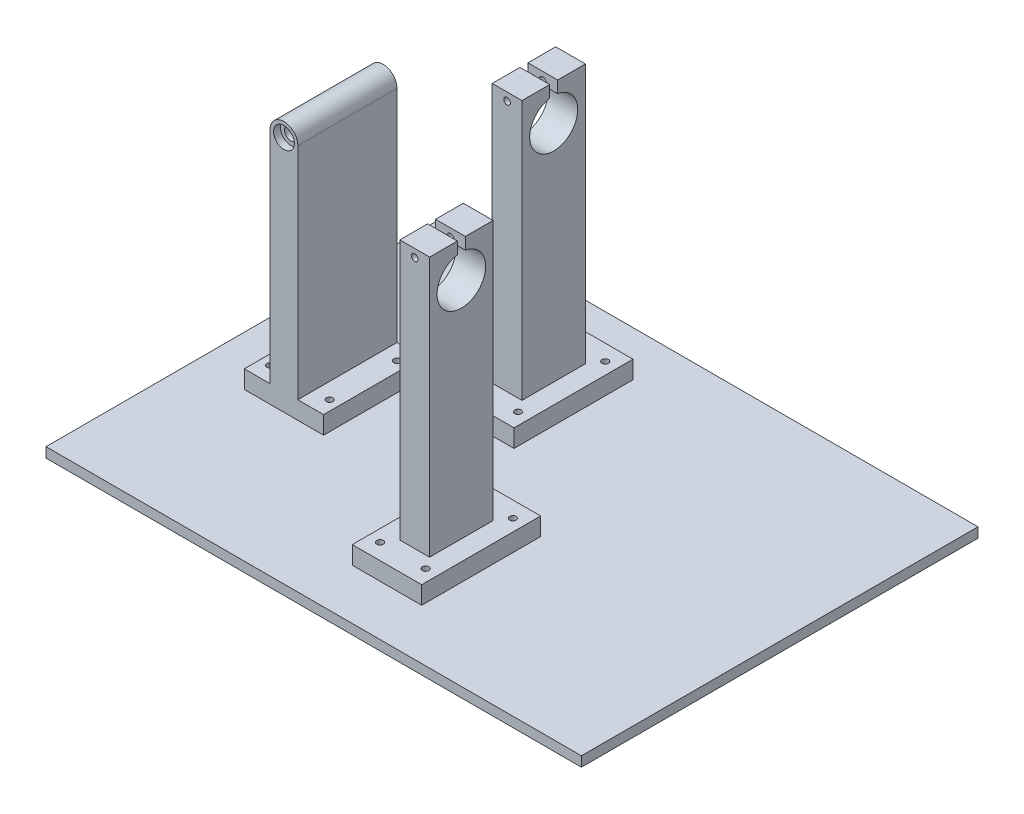
from build123d import *

# Parameters (mm, degrees)
SKETCH_2_W                 = 240.549430728
SKETCH_2_H                 = 149.540933388
EXTRUDE_1_DEPTH            = 5
SKETCH_6_W                 = 93.246571425
SKETCH_6_H                 = 149.540933388
EXTRUDE_4_DEPTH            = 5
SKETCH_8_W                 = 274.716709757
SKETCH_8_H                 = 58.51354913
EXTRUDE_6_DEPTH            = 5
CUT_EXTRUDE_2_DEPTH        = 252.755772101
CUT_EXTRUDE_2_DEPTH_BACK   = 252.755772101
SKETCH_9_W                 = 59.079292396
SKETCH_9_H                 = 149.540933388
SKETCH_10_W                = 104.703380117
SKETCH_10_H                = 208.054482518
CUT_EXTRUDE_3_DEPTH        = 10
SKETCH_12_W                = 200
SKETCH_12_H                = 200
EXTRUDE_7_DEPTH            = 5
SKETCH_13_OUTSIDE_W        = 259.728
SKETCH_13_OUTSIDE_H        = 267.782
SKETCH_13_OUTSIDE_W_2      = 200
SKETCH_13_OUTSIDE_H_2      = 200
CUT_EXTRUDE_4_DEPTH        = 278.64321362
EXTRUDE_START              = -75
SKETCH_18_R                = 5.25
EXTRUDE_9_DEPTH            = 10
EXTRUDE_START_2            = -46
EXTRUDE_10_DEPTH           = 15
EXTRUDE_START_3            = -91.2
EXTRUDE_11_DEPTH           = 15
EXTRUDE_12_REACH           = 307.894
SKETCH_20_R                = 5.25
SKETCH_26_W                = 200
SKETCH_26_H                = 5
EXTRUDE_13_DEPTH           = 100
SKETCH_27_W                = 200
SKETCH_27_H                = 5
CUT_EXTRUDE_5_DEPTH        = 30
EXTRUDE_14_DEPTH           = 10
SKETCH_29_W                = 60
SKETCH_29_H                = 9
EXTRUDE_15_DEPTH           = 10
HOLE_WIZARD_M4_1_OUTLINE_R = 1.65
HOLE_WIZARD_M4_1_DEPTH     = 14
HOLE_WIZARD_M4_2_D         = 3.3
HOLE_START                 = -37.990466694
HOLE_WIZARD_M4_3_OUTLINE_R = 1.65
HOLE_WIZARD_M4_3_DEPTH     = 32
EXTRUDE_16_DEPTH           = 10
SKETCH_37_W                = 60
SKETCH_37_H                = 9
EXTRUDE_17_DEPTH           = 10
HOLE_WIZARD_M4_4_OUTLINE_R = 1.65
HOLE_WIZARD_M4_4_DEPTH     = 14
EXTRUDE_START_4            = -3.5
SKETCH_40_R                = 5.25
SKETCH_40_R_2              = 3.25
EXTRUDE_18_DEPTH           = 46.5
CUT_EXTRUDE_START          = -3.5
SKETCH_41_R                = 5.25
SKETCH_41_R_2              = 3.25
CUT_EXTRUDE_6_DEPTH        = 3.5
HOLE_WIZARD_M4_5_OUTLINE_R = 1.65
HOLE_WIZARD_M4_5_DEPTH     = 14


# Read off the part's stored shape, not the designer's step: M4 螺纹孔1, M4 螺纹孔3, M4 螺纹孔4, M4 螺纹孔5
with BuildPart() as part:
    # 草图2 → 凸台-拉伸1 (new body)
    with BuildSketch(Plane(origin=(0, 0, 0), x_dir=(1, 0, 0), z_dir=(0, 1, 0))):
        Rectangle(SKETCH_2_W, SKETCH_2_H)
    extrude(amount=EXTRUDE_1_DEPTH)

    # 草图6 → 凸台-拉伸4 (add)
    with BuildSketch(Plane(origin=(0, 5, 0), x_dir=(1, 0, 0), z_dir=(0, 1, 0))):
        with Locations((166.898001077, 0)):
            Rectangle(SKETCH_6_W, SKETCH_6_H)
    extrude(amount=-EXTRUDE_4_DEPTH)

    # 草图8 → 凸台-拉伸6 (add)
    with BuildSketch(Plane(origin=(0, 5, 0), x_dir=(1, 0, 0), z_dir=(0, 1, 0))):
        with Locations((76.162931911, -104.027241259)):
            Rectangle(SKETCH_8_W, SKETCH_8_H)
    extrude(amount=-EXTRUDE_6_DEPTH)

    # 草图9 → 切除-拉伸2 (cut, two sides: drawn at the far end of the back side and taken through both)
    with BuildSketch(Plane(origin=(0, 5, 0), x_dir=(1, 0, 0), z_dir=(0, 1, 0)).offset(-CUT_EXTRUDE_2_DEPTH_BACK)):
        with Locations((-90.735069166, 0)):
            Rectangle(SKETCH_9_W, SKETCH_9_H)
    extrude(amount=CUT_EXTRUDE_2_DEPTH + CUT_EXTRUDE_2_DEPTH_BACK, mode=Mode.SUBTRACT)

    # 草图10 → 切除-拉伸3 (cut)
    with BuildSketch(Plane(origin=(0, 5, 0), x_dir=(1, 0, 0), z_dir=(0, 1, 0))):
        with Locations((-8.84373291, -29.256774565)):
            Rectangle(SKETCH_10_W, SKETCH_10_H)
    extrude(amount=-CUT_EXTRUDE_3_DEPTH, mode=Mode.SUBTRACT)

    # 草图12 → 凸台-拉伸7 (add)
    with BuildSketch(Plane(origin=(0, 5, 0), x_dir=(1, 0, 0), z_dir=(0, 1, 0))):
        with Locations((143.507957149, -25.229533306)):
            Rectangle(SKETCH_12_W, SKETCH_12_H)
    extrude(amount=-EXTRUDE_7_DEPTH)

    # 草图13 outside → 切除-拉伸4 (cut, through all)
    with BuildSketch(Plane(origin=(0, 5, 0), x_dir=(1, 0, 0), z_dir=(0, 1, 0))):
        with Locations((143.508, -29.257)):
            Rectangle(SKETCH_13_OUTSIDE_W, SKETCH_13_OUTSIDE_H)
        with Locations((143.507957149, -25.229533306)):
            Rectangle(SKETCH_13_OUTSIDE_W_2, SKETCH_13_OUTSIDE_H_2, mode=Mode.SUBTRACT)
    extrude(amount=-CUT_EXTRUDE_4_DEPTH, mode=Mode.SUBTRACT)

    # 草图18 → 凸台-拉伸9 (add)
    with BuildSketch(Plane.XY.offset(125.229533306).offset(EXTRUDE_START)):
        with BuildLine():
            Line((95.507957149, 14), (95.507957149, 125))
            ThreePointArc((95.507957149, 125), (88.507957149, 132), (81.507957149, 125))
            Line((81.507957149, 125), (81.507957149, 14))
            Line((81.507957149, 14), (68.507957149, 14))
            Line((68.507957149, 14), (68.507957149, 5))
            Line((68.507957149, 5), (108.507957149, 5))
            Line((108.507957149, 5), (108.507957149, 14))
            Line((108.507957149, 14), (95.507957149, 14))
        make_face()
        with Locations((88.507957149, 125)):
            Circle(SKETCH_18_R, mode=Mode.SUBTRACT)
    extrude_9 = extrude(amount=-EXTRUDE_9_DEPTH)

    # 镜向1: 凸台-拉伸9 across plane
    add(extrude_9.mirror(Plane.XY.offset(25.229533306)))

    # 草图16 → 凸台-拉伸10 (add)
    with BuildSketch(Plane(origin=(243.507957149, 0, 0), x_dir=(0, 0, -1), z_dir=(1, 0, 0)).offset(EXTRUDE_START_2)):
        with BuildLine():
            Line((-53.779533306, 14), (-53.779533306, 145.085631965))
            Line((-53.779533306, 145.085631965), (-67.779533306, 145.085631965))
            Line((-67.779533306, 145.085631965), (-67.779533306, 139.085631965))
            ThreePointArc((-67.779533306, 139.085631965), (-69.779533306, 114.75), (-71.779533306, 139.085631965))
            Line((-71.779533306, 139.085631965), (-71.779533306, 145.085631965))
            Line((-71.779533306, 145.085631965), (-85.779533306, 145.085631965))
            Line((-85.779533306, 145.085631965), (-85.779533306, 14))
            Line((-85.779533306, 14), (-99.779533306, 14))
            Line((-99.779533306, 14), (-99.779533306, 5))
            Line((-99.779533306, 5), (-39.779533306, 5))
            Line((-39.779533306, 5), (-39.779533306, 14))
            Line((-39.779533306, 14), (-53.779533306, 14))
        make_face()
    extrude(amount=-EXTRUDE_10_DEPTH)

    # 草图19 → 凸台-拉伸11 (add)
    with BuildSketch(Plane(origin=(243.507957149, 0, 0), x_dir=(0, 0, -1), z_dir=(1, 0, 0)).offset(EXTRUDE_START_3)):
        with BuildLine():
            Line((37.990466694, 14), (37.990466694, 144.933566106))
            Line((37.990466694, 144.933566106), (23.990466694, 144.933566106))
            Line((23.990466694, 144.933566106), (23.990466694, 138.933566106))
            ThreePointArc((23.990466694, 138.933566106), (21.990466694, 114.9), (19.990466694, 138.933566106))
            Line((19.990466694, 138.933566106), (19.990466694, 144.933566106))
            Line((19.990466694, 144.933566106), (5.990466694, 144.933566106))
            Line((5.990466694, 144.933566106), (5.990466694, 14))
            Line((5.990466694, 14), (-8.009533306, 14))
            Line((-8.009533306, 14), (-8.009533306, 5))
            Line((-8.009533306, 5), (51.990466694, 5))
            Line((51.990466694, 5), (51.990466694, 14))
            Line((51.990466694, 14), (37.990466694, 14))
        make_face()
    extrude(amount=-EXTRUDE_11_DEPTH)

    # 草图20 → 凸台-拉伸12 (add, up to next)
    with BuildSketch(Plane(origin=(0, 0, 40.229533306), x_dir=(-1, 0, 0), z_dir=(0, 0, -1)), mode=Mode.PRIVATE) as extrude_12_sk1:
        with BuildLine():
            Line((-108.507957149, 5), (-68.507957149, 5))
            Line((-68.507957149, 5), (-68.507957149, 14))
            Line((-68.507957149, 14), (-81.507957149, 14))
            Line((-81.507957149, 14), (-81.507957149, 125))
            ThreePointArc((-81.507957149, 125), (-88.507957149, 132), (-95.507957149, 125))
            Line((-95.507957149, 125), (-95.507957149, 14))
            Line((-95.507957149, 14), (-108.507957149, 14))
            Line((-108.507957149, 14), (-108.507957149, 5))
        make_face()
        with Locations(Location((-88.507957149, 125, 0), (0, 0, 180))):
            Circle(SKETCH_20_R, mode=Mode.SUBTRACT)
    extrude_12_tool1 = extrude(extrude_12_sk1.sketch, amount=EXTRUDE_12_REACH, mode=Mode.PRIVATE) - part.part
    add(extrude_12_tool1.solids().sort_by_distance((88.507957, 57.997401, 40.229533))[0])

    # 草图26 → 凸台-拉伸13 (add)
    with BuildSketch(Plane(origin=(243.507957149, 0, 0), x_dir=(0, 0, -1), z_dir=(1, 0, 0))):
        with Locations((-25.229533306, 2.5)):
            Rectangle(SKETCH_26_W, SKETCH_26_H)
    extrude(amount=EXTRUDE_13_DEPTH)

    # 草图27 → 切除-拉伸5 (cut)
    with BuildSketch(Plane(origin=(343.507957149, 0, 0), x_dir=(0, 0, -1), z_dir=(1, 0, 0))):
        with Locations((-25.229533306, 2.5)):
            Rectangle(SKETCH_27_W, SKETCH_27_H)
    extrude(amount=-CUT_EXTRUDE_5_DEPTH, mode=Mode.SUBTRACT)

    # 草图28 → 凸台-拉伸14 (add)
    with BuildSketch(Plane(origin=(197.507957149, 0, 0), x_dir=(0, 0, -1), z_dir=(1, 0, 0))):
        Polygon((-85.779533306, 14), (-53.779533306, 14), (-39.779533306, 14), (-39.779533306, 5), (-99.779533306, 5), (-99.779533306, 14), align=None)
    extrude(amount=EXTRUDE_14_DEPTH)

    # 草图29 → 凸台-拉伸15 (add)
    with BuildSketch(Plane.ZY.offset(-182.507957149)):
        with Locations((69.779533306, 9.5)):
            Rectangle(SKETCH_29_W, SKETCH_29_H)
    extrude(amount=EXTRUDE_15_DEPTH)

    # M4 螺纹孔1 outline → M4 螺纹孔1 (cut)
    with BuildSketch(Plane(origin=(0, 0, 0), x_dir=(1, 0, 0), z_dir=(0, 1, 0))):
        with Locations((178.507957149, -91.779533306)):
            Circle(HOLE_WIZARD_M4_1_OUTLINE_R)
        with Locations((201.507957149, -91.779533306)):
            Circle(HOLE_WIZARD_M4_1_OUTLINE_R)
        with Locations((201.507957149, -47.779533306)):
            Circle(HOLE_WIZARD_M4_1_OUTLINE_R)
        with Locations((178.507957149, -47.779533306)):
            Circle(HOLE_WIZARD_M4_1_OUTLINE_R)
    extrude(amount=HOLE_WIZARD_M4_1_DEPTH, mode=Mode.SUBTRACT)

    # M4 螺纹孔2 (through all)
    with Locations(Plane.XY.offset(85.779533306)):
        with Locations((190.007957149, 141.085631965)):
            Hole(HOLE_WIZARD_M4_2_D / 2)

    # M4 螺纹孔3 outline → M4 螺纹孔3 (cut)
    with BuildSketch(Plane.XY.offset(HOLE_START)):
        with Locations((144.807957149, 140.933566106)):
            Circle(HOLE_WIZARD_M4_3_OUTLINE_R)
    extrude(amount=HOLE_WIZARD_M4_3_DEPTH, mode=Mode.SUBTRACT)

    # 草图36 → 凸台-拉伸16 (add)
    with BuildSketch(Plane(origin=(152.307957149, 0, 0), x_dir=(0, 0, -1), z_dir=(1, 0, 0))):
        Polygon((5.990466694, 14), (37.990466694, 14), (51.990466694, 14), (51.990466694, 5), (-8.009533306, 5), (-8.009533306, 14), align=None)
    extrude(amount=EXTRUDE_16_DEPTH)

    # 草图37 → 凸台-拉伸17 (add)
    with BuildSketch(Plane.ZY.offset(-137.307957149)):
        with Locations((-21.990466694, 9.5)):
            Rectangle(SKETCH_37_W, SKETCH_37_H)
    extrude(amount=EXTRUDE_17_DEPTH)

    # M4 螺纹孔4 outline → M4 螺纹孔4 (cut)
    with BuildSketch(Plane(origin=(0, 0, 0), x_dir=(1, 0, 0), z_dir=(0, 1, 0))):
        with Locations((133.307957149, -0.009533306)):
            Circle(HOLE_WIZARD_M4_4_OUTLINE_R)
        with Locations((156.307957149, -0.009533306)):
            Circle(HOLE_WIZARD_M4_4_OUTLINE_R)
        with Locations((156.307957149, 43.990466694)):
            Circle(HOLE_WIZARD_M4_4_OUTLINE_R)
        with Locations((133.307957149, 43.990466694)):
            Circle(HOLE_WIZARD_M4_4_OUTLINE_R)
    extrude(amount=HOLE_WIZARD_M4_4_DEPTH, mode=Mode.SUBTRACT)

    # 草图40 → 凸台-拉伸18 (add)
    with BuildSketch(Plane.XY.offset(50.229533306).offset(EXTRUDE_START_4)):
        with Locations((88.507957149, 125)):
            Circle(SKETCH_40_R)
        with Locations((88.507957149, 125)):
            Circle(SKETCH_40_R_2, mode=Mode.SUBTRACT)
    extrude(amount=-EXTRUDE_18_DEPTH)

    # 草图41 → 切除-拉伸6 (cut)
    with BuildSketch(Plane(origin=(0, 0, 0.229533306), x_dir=(-1, 0, 0), z_dir=(0, 0, -1)).offset(CUT_EXTRUDE_START)):
        with Locations(Location((-88.507957149, 125, 0), (0, 0, 180))):
            Circle(SKETCH_41_R)
        with Locations(Location((-88.507957149, 125, 0), (0, 0, 180))):
            Circle(SKETCH_41_R_2, mode=Mode.SUBTRACT)
    extrude(amount=CUT_EXTRUDE_6_DEPTH, mode=Mode.SUBTRACT)

    # M4 螺纹孔5 outline → M4 螺纹孔5 (cut)
    with BuildSketch(Plane(origin=(0, 0, 0), x_dir=(1, 0, 0), z_dir=(0, 1, 0))):
        with Locations((73.507957149, -42.229533306)):
            Circle(HOLE_WIZARD_M4_5_OUTLINE_R)
        with Locations((103.507957149, -42.229533306)):
            Circle(HOLE_WIZARD_M4_5_OUTLINE_R)
        with Locations((103.507957149, -8.229533306)):
            Circle(HOLE_WIZARD_M4_5_OUTLINE_R)
        with Locations((73.507957149, -8.229533306)):
            Circle(HOLE_WIZARD_M4_5_OUTLINE_R)
    extrude(amount=HOLE_WIZARD_M4_5_DEPTH, mode=Mode.SUBTRACT)


solid = part.part
